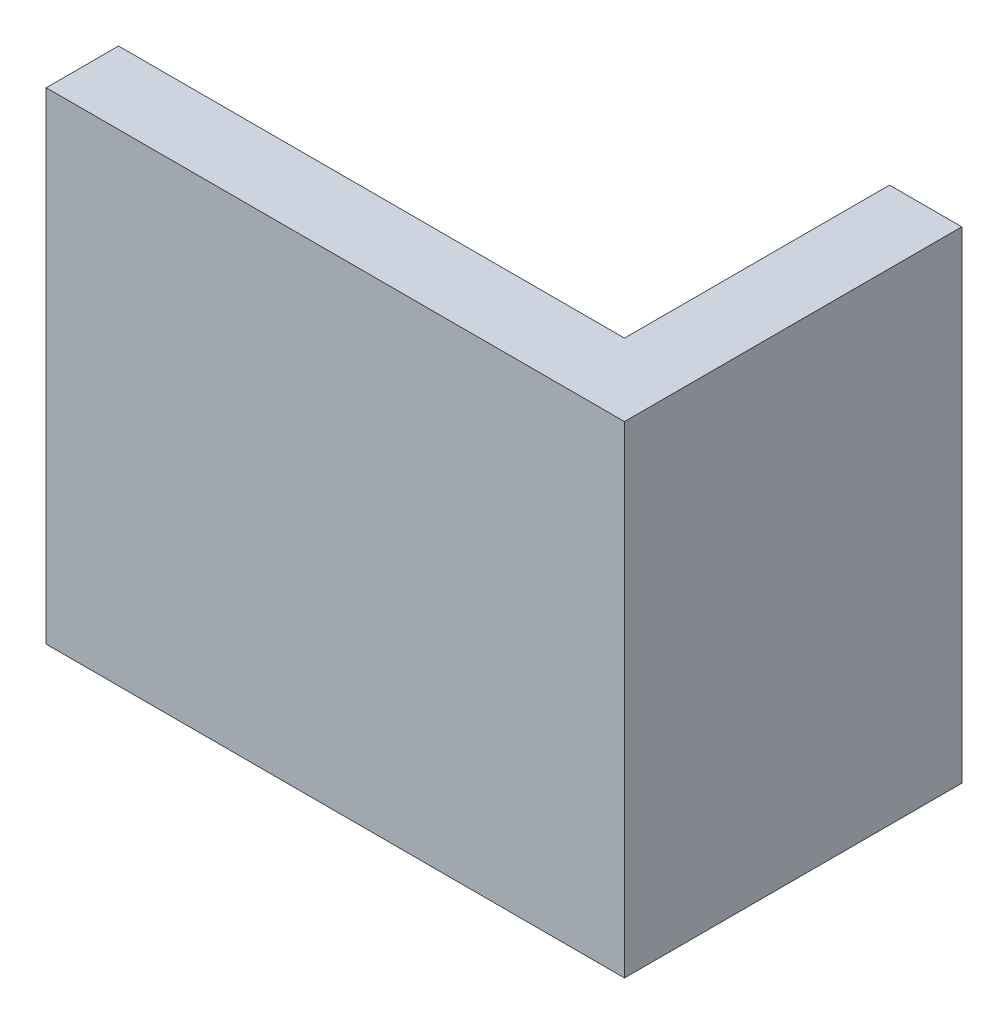
from build123d import *

# Parameters (mm, degrees)
BOSS_EXTRUDE1_DEPTH = 10


with BuildPart() as part:
    # Sketch1 → Boss-Extrude1 (new, symmetric)
    with BuildSketch(Plane(origin=(0, 0, 0), x_dir=(1, 0, 0), z_dir=(0, 1, 0))):
        Polygon((9, -3), (9, 8), (12, 8), (12, -6), (-12, -6), (-12, -3), align=None)
    extrude(amount=BOSS_EXTRUDE1_DEPTH, both=True)


solid = part.part
